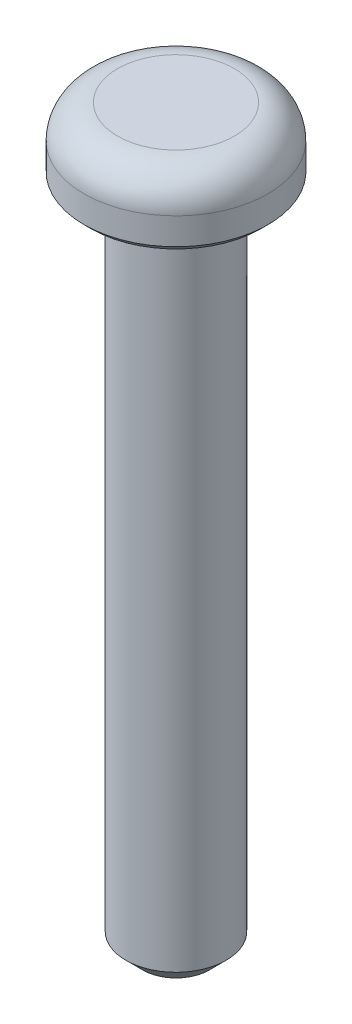
from build123d import *

# Parameters (mm, degrees)
FILLET1_R     = 1
CHAMFER1_SIZE = 0.5
CHAMFER2_SIZE = 0.2


with BuildPart() as part:
    # Sketch1 → Revolve1 (revolve)
    with BuildSketch(Plane.XY):
        Polygon((0, 0), (0, 22), (2.75, 22), (2.75, 20), (1.5, 20), (1.5, 0), align=None)
    revolve(axis=Axis((0, 0, 0), (0, 1, 0)))

    # Fillet1
    fillet1_edges = [part.edges().sort_by_distance(p)[0] for p in [
        (-2.75, 22, 0),
    ]]
    fillet(fillet1_edges, radius=FILLET1_R)

    # Chamfer1
    chamfer1_edges = [part.edges().sort_by_distance(p)[0] for p in [
        (-1.5, 0, 0),
    ]]
    chamfer(chamfer1_edges, length=CHAMFER1_SIZE)

    # Chamfer2
    chamfer2_edges = [part.edges().sort_by_distance(p)[0] for p in [
        (-2.75, 20, 0),
    ]]
    chamfer(chamfer2_edges, length=CHAMFER2_SIZE)


solid = part.part
